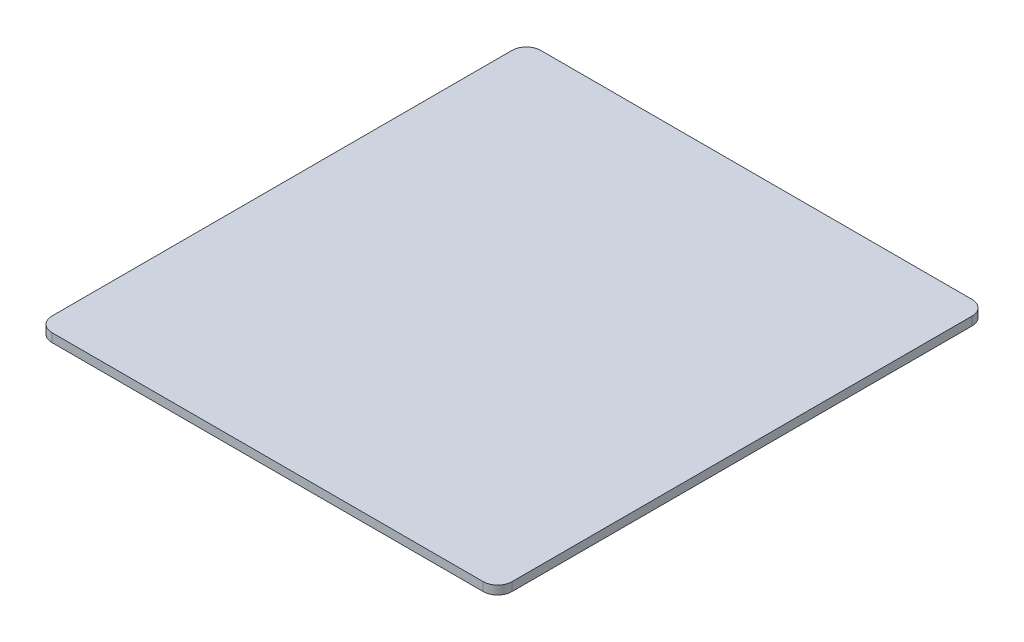
from build123d import *

# Parameters (mm, degrees)
EXTRUDE_1_DEPTH = 6


with BuildPart() as part:
    # Эскиз1 → Бобышка-Вытянуть1 (new body)
    with BuildSketch(Plane(origin=(0, 0, 0), x_dir=(1, 0, 0), z_dir=(0, 1, 0))):
        with BuildLine():
            Line((-150, -160), (150, -160))
            ThreePointArc((150, -160), (157.071067812, -157.071067812), (160, -150))
            Line((160, -150), (160, 170))
            ThreePointArc((160, 170), (157.071067812, 177.071067812), (150, 180))
            Line((150, 180), (-150, 180))
            ThreePointArc((-150, 180), (-157.071067812, 177.071067812), (-160, 170))
            Line((-160, 170), (-160, -150))
            ThreePointArc((-160, -150), (-157.071067812, -157.071067812), (-150, -160))
        make_face()
    extrude(amount=EXTRUDE_1_DEPTH)


solid = part.part
